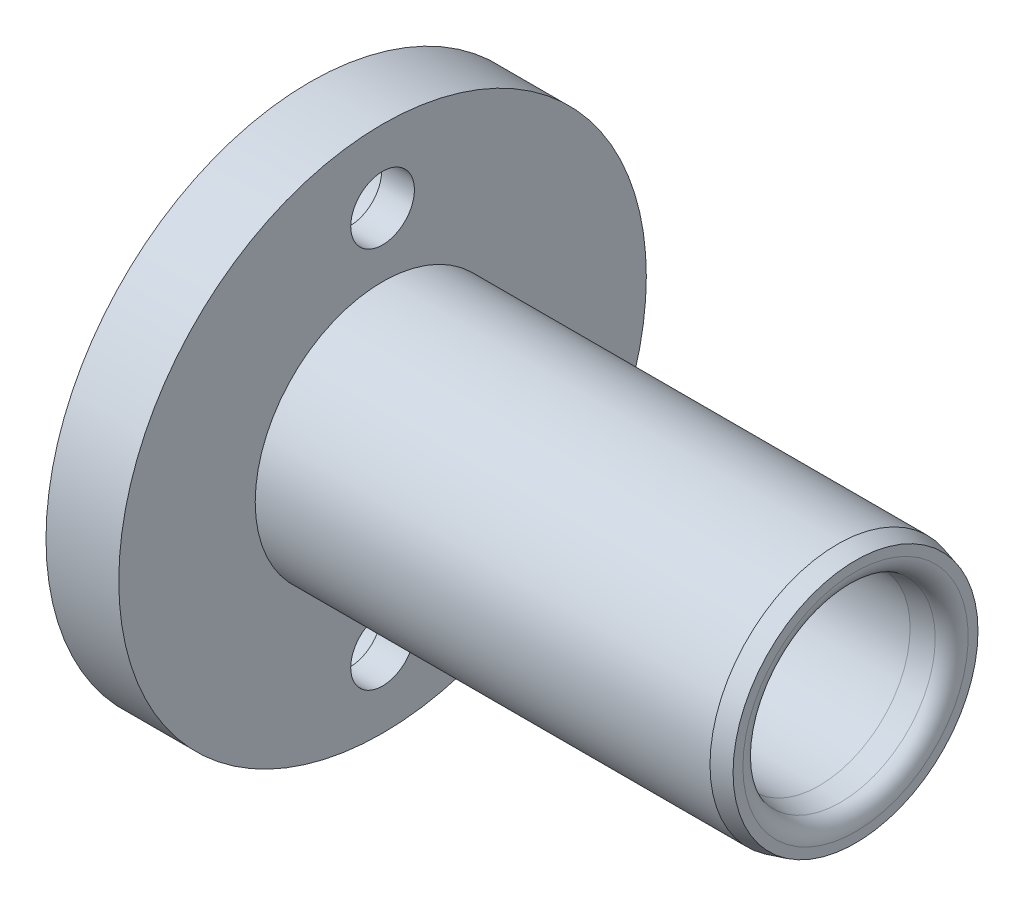
from build123d import *

# Parameters (mm, degrees)
CHAMFER1_SIZE          = 1
CHAMFER1_SIZE2         = 0.267949192
CHAMFER2_SIZE          = 2
CHAMFER2_SIZE2         = 0.352653961
CHAMFER3_SIZE          = 3
CHAMFER3_SIZE2         = 0.528980942
FILLET1_R              = 1
CAP_SCREW1_D           = 3.5
CAP_SCREW1_CBORE_D     = 6
CAP_SCREW1_CBORE_DEPTH = 2.2


with BuildPart() as part:
    # Sketch1 → Revolve1 (revolve)
    with BuildSketch(Plane.XY):
        Polygon((-4, 5), (26, 5), (26, 7), (0, 7), (0, 14.5), (-4, 14.5), align=None)
    revolve(axis=Axis((0, 0, 0), (1, 0, 0)))

    # Chamfer1
    chamfer1_edges = [part.edges().sort_by_distance(p)[0] for p in [
        (26, -7, 0),
    ]]
    chamfer1_side = [part.faces().sort_by_distance(p)[0] for p in [
        (13, -7, 0),
    ]]
    chamfer(chamfer1_edges, length=CHAMFER1_SIZE, length2=CHAMFER1_SIZE2, reference=chamfer1_side[0])

    # Chamfer2
    chamfer2_edges = [part.edges().sort_by_distance(p)[0] for p in [
        (26, -5, 0),
    ]]
    chamfer2_side = [part.faces().sort_by_distance(p)[0] for p in [
        (11, -5, 0),
    ]]
    chamfer(chamfer2_edges, length=CHAMFER2_SIZE, length2=CHAMFER2_SIZE2, reference=chamfer2_side[0])

    # Chamfer3
    chamfer3_edges = [part.edges().sort_by_distance(p)[0] for p in [
        (-4, -5, 0),
    ]]
    chamfer3_side = [part.faces().sort_by_distance(p)[0] for p in [
        (10, -5, 0),
    ]]
    chamfer(chamfer3_edges, length=CHAMFER3_SIZE, length2=CHAMFER3_SIZE2, reference=chamfer3_side[0])

    # Fillet1
    fillet1_edges = [part.edges().sort_by_distance(p)[0] for p in [
        (26, -5.352653961, 0),
        (-4, -5.528980942, 0),
    ]]
    fillet(fillet1_edges, radius=FILLET1_R)

    # Cap Screw1 (through all)
    with Locations(Plane.ZY.offset(4)):
        with Locations((0, 10.5), (0, -10.5)):
            CounterBoreHole(CAP_SCREW1_D / 2, CAP_SCREW1_CBORE_D / 2, CAP_SCREW1_CBORE_DEPTH)


solid = part.part
